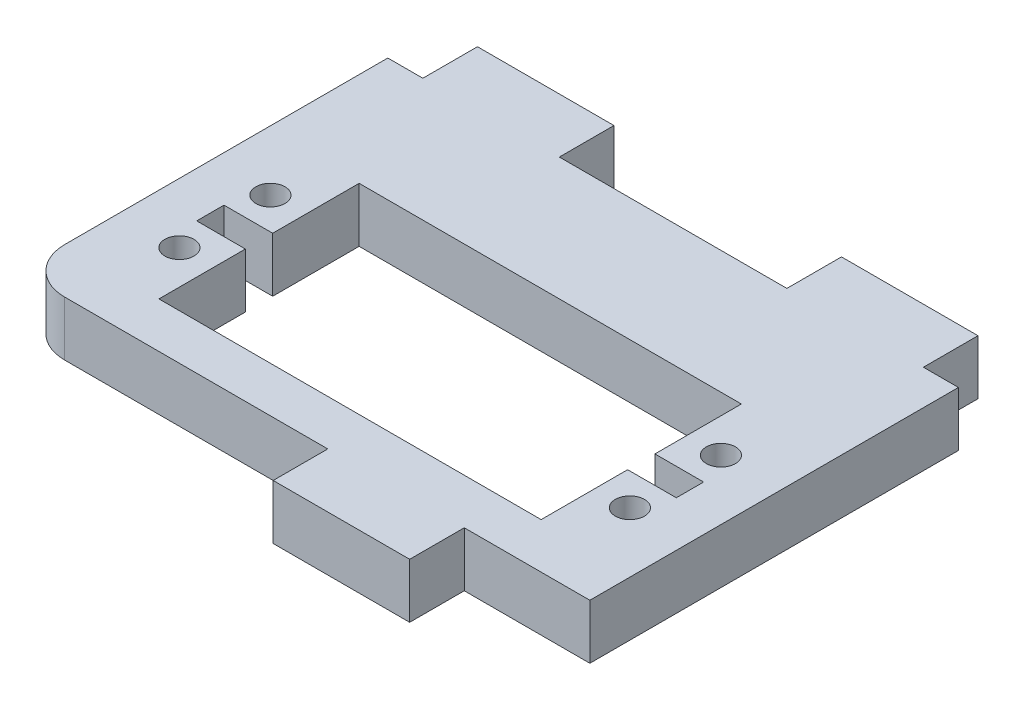
from build123d import *

# Parameters (mm, degrees)
ESBO_O1_R                = 1.6
RESSALTO_EXTRUS_O1_DEPTH = 6


with BuildPart() as part:
    # Esboço1 → Ressalto-extrusão1 (new body)
    with BuildSketch(Plane.XZ.offset(6)):
        with BuildLine():
            Line((2.55259, 16), (-26.35, 16))
            ThreePointArc((-26.35, 16), (-29.885533906, 14.535533906), (-31.35, 11))
            Line((-31.35, 11), (-31.35, -24.5))
            Line((-31.35, -24.5), (-27.5, -24.5))
            Line((-27.5, -24.5), (-27.5, -30.5))
            Line((-27.5, -30.5), (-12.5, -30.5))
            Line((-12.5, -30.5), (-12.5, -24.5))
            Line((-12.5, -24.5), (12.5, -24.5))
            Line((12.5, -24.5), (12.5, -30.5))
            Line((12.5, -30.5), (27.5, -30.5))
            Line((27.5, -30.5), (27.5, -24.5))
            Line((27.5, -24.5), (31.35, -24.5))
            Line((31.35, -24.5), (31.35, 16))
            Line((31.35, 16), (17.55259, 16))
            Line((17.55259, 16), (17.55259, 22))
            Line((17.55259, 22), (2.55259, 22))
            Line((2.55259, 22), (2.55259, 16))
        make_face()
        with Locations((24.75, 5)):
            Circle(ESBO_O1_R, mode=Mode.SUBTRACT)
        with Locations((24.75, -5)):
            Circle(ESBO_O1_R, mode=Mode.SUBTRACT)
        with Locations((-24.75, 5)):
            Circle(ESBO_O1_R, mode=Mode.SUBTRACT)
        with Locations((-24.75, -5)):
            Circle(ESBO_O1_R, mode=Mode.SUBTRACT)
        Polygon((-26.35, 1.5), (-21, 1.5), (-21, 11), (21, 11), (21, 1.5), (26.35, 1.5), (26.35, -1.5), (21, -1.5), (21, -11), (-21, -11), (-21, -1.5), (-26.35, -1.5), align=None, mode=Mode.SUBTRACT)
    extrude(amount=-RESSALTO_EXTRUS_O1_DEPTH)


solid = part.part
